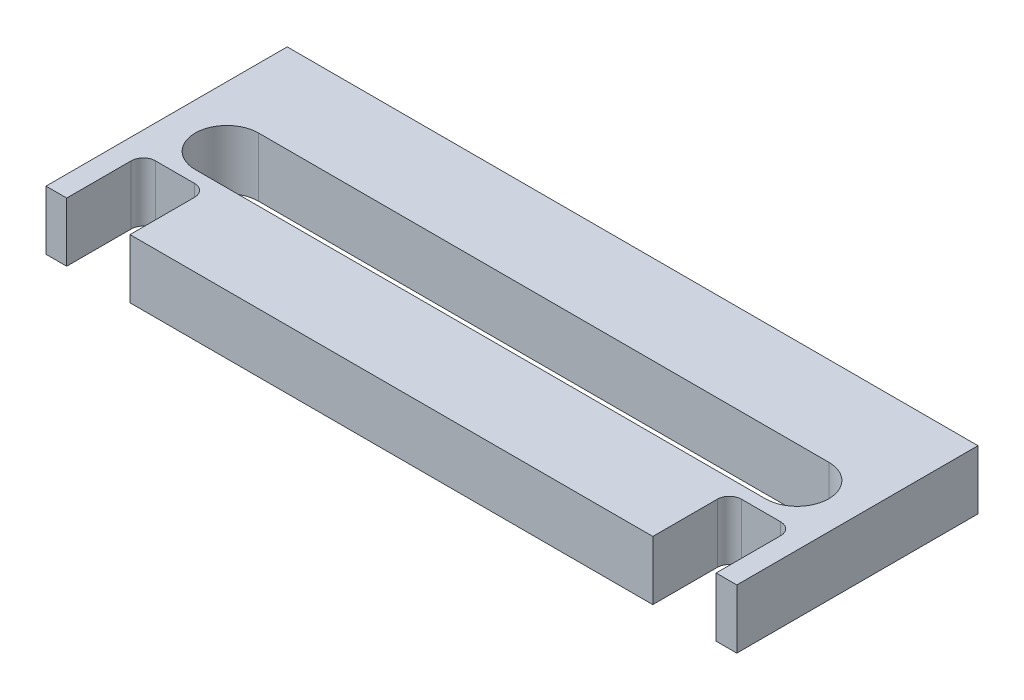
from build123d import *

# Parameters (mm, degrees)
BOSS_EXTRUDE5_DEPTH   = 10
CUT_EXTRUDE6_DEPTH    = 5
FILLET4_R             = 1
FILLET4_OF_MIRROR25_R = 1
BOSS_EXTRUDE6_DEPTH   = 4.9
MIRROR27_START        = 5.1
MIRROR27_DEPTH        = 4.9


# Read off the part's stored shape, not the designer's step: Mirror27
with BuildPart() as part:
    # Sketch15 → Boss-Extrude5 (new body)
    with BuildSketch(Plane(origin=(0, 0, 0), x_dir=(1, 0, 0), z_dir=(0, 1, 0))):
        Polygon((24.3, 76.900659127), (-6.625, 76.900659127), (-6.625, -4.5), (24.3, -4.5), (24.3, 44.900659127), (21.675, 44.900659127), (21.675, 47.400659127), (21.675, 72.400659127), (21.675, 74.900659127), (24.3, 74.900659127), align=None)
        Polygon((-2.625, 25), (-2.625, 0), (-2.625, -2.5), (0, -2.5), (2.625, -2.5), (2.625, 0), (2.625, 25), (2.625, 27.5), (0, 27.5), (-2.625, 27.5), align=None, mode=Mode.SUBTRACT)
    boss_extrude5 = extrude(amount=BOSS_EXTRUDE5_DEPTH)

    # Sketch18 → Cut-Extrude6 (cut)
    with BuildSketch(Plane(origin=(0, 10, 0), x_dir=(1, 0, 0), z_dir=(0, 1, 0))):
        Polygon((21.675, 51.3980649), (-4.44053483, 51.3980649), (-4.44053483, 20.8980649), (24.3, 20.8980649), (24.3, 51.3980649), align=None)
    cut_extrude6 = extrude(amount=-CUT_EXTRUDE6_DEPTH, mode=Mode.SUBTRACT)

    # Fillet4
    fillet4_edges = [part.edges().sort_by_distance(p)[0] for p in [
        (21.675, 5, -74.900659127),
        (-2.625, 5, 2.5),
        (2.625, 5, 2.5),
        (2.625, 2.5, -27.5),
        (-2.625, 2.5, -27.5),
        (21.675, 2.5, -44.900659127),
    ]]
    fillet(fillet4_edges, radius=FILLET4_R)

    # Mirror25: Boss-Extrude5, Cut-Extrude6 across plane
    add(boss_extrude5.mirror(Plane(origin=(24.3, 10, 4.5), x_dir=(0, 0, 1), z_dir=(-1, 0, 0))))
    add(cut_extrude6.mirror(Plane(origin=(24.3, 10, 4.5), x_dir=(0, 0, 1), z_dir=(-1, 0, 0))), mode=Mode.SUBTRACT)

    # Fillet4 of Mirror25
    fillet4_of_mirror25_edges = [part.edges().sort_by_distance(p)[0] for p in [
        (26.925, 5, -74.900659127),
        (51.225, 5, 2.5),
        (45.975, 5, 2.5),
        (45.975, 2.5, -27.5),
        (51.225, 2.5, -27.5),
        (26.925, 2.5, -44.900659127),
    ]]
    fillet(fillet4_of_mirror25_edges, radius=FILLET4_OF_MIRROR25_R)


with BuildPart() as body_2:
    # Sketch19 → Boss-Extrude6 (new body)
    with BuildSketch(Plane(origin=(0, 10, 0), x_dir=(1, 0, 0), z_dir=(0, 1, 0))):
        with BuildLine():
            Line((2.625, 21.1480649), (2.625, 26.5))
            ThreePointArc((2.625, 26.5), (2.332106781, 27.207106781), (1.625, 27.5))
            Line((1.625, 27.5), (-1.625, 27.5))
            ThreePointArc((-1.625, 27.5), (-2.332106781, 27.207106781), (-2.625, 26.5))
            Line((-2.625, 26.5), (-2.625, 21.1480649))
            Line((-2.625, 21.1480649), (-4.34053483, 21.1480649))
            Line((-4.34053483, 21.1480649), (-4.34053483, 41.1480649))
            Line((-4.34053483, 41.1480649), (24.3, 41.1480649))
            Line((24.3, 41.1480649), (24.3, 33.7730649))
            Line((24.3, 33.7730649), (0.65946517, 33.7730649))
            ThreePointArc((0.65946517, 33.7730649), (-1.96553483, 31.1480649), (0.65946517, 28.5230649))
            Line((0.65946517, 28.5230649), (24.3, 28.5230649))
            Line((24.3, 28.5230649), (24.3, 21.1480649))
            Line((24.3, 21.1480649), (2.625, 21.1480649))
        make_face()
    extrude(amount=-BOSS_EXTRUDE6_DEPTH)

    # Mirror27 outline → Mirror27 (add)
    with BuildSketch(Plane(origin=(0, 0, 0), x_dir=(1, 0, 0), z_dir=(0, 1, 0)).offset(MIRROR27_START)):
        with BuildLine():
            ThreePointArc((45.975, 26.5), (46.267893219, 27.207106781), (46.975, 27.5))
            Line((46.975, 27.5), (50.225, 27.5))
            ThreePointArc((50.225, 27.5), (50.932106781, 27.207106781), (51.225, 26.5))
            Line((51.225, 26.5), (51.225, 21.1480649))
            Line((51.225, 21.1480649), (52.94053483, 21.1480649))
            Line((52.94053483, 21.1480649), (52.94053483, 41.1480649))
            Line((52.94053483, 41.1480649), (24.3, 41.1480649))
            Line((24.3, 41.1480649), (24.3, 33.7730649))
            Line((24.3, 33.7730649), (47.94053483, 33.7730649))
            ThreePointArc((47.94053483, 33.7730649), (50.56553483, 31.1480649), (47.94053483, 28.5230649))
            Line((47.94053483, 28.5230649), (24.3, 28.5230649))
            Line((24.3, 28.5230649), (24.3, 21.1480649))
            Line((24.3, 21.1480649), (45.975, 21.1480649))
            Line((45.975, 21.1480649), (45.975, 26.5))
        make_face()
    extrude(amount=MIRROR27_DEPTH)


solid = body_2.part
